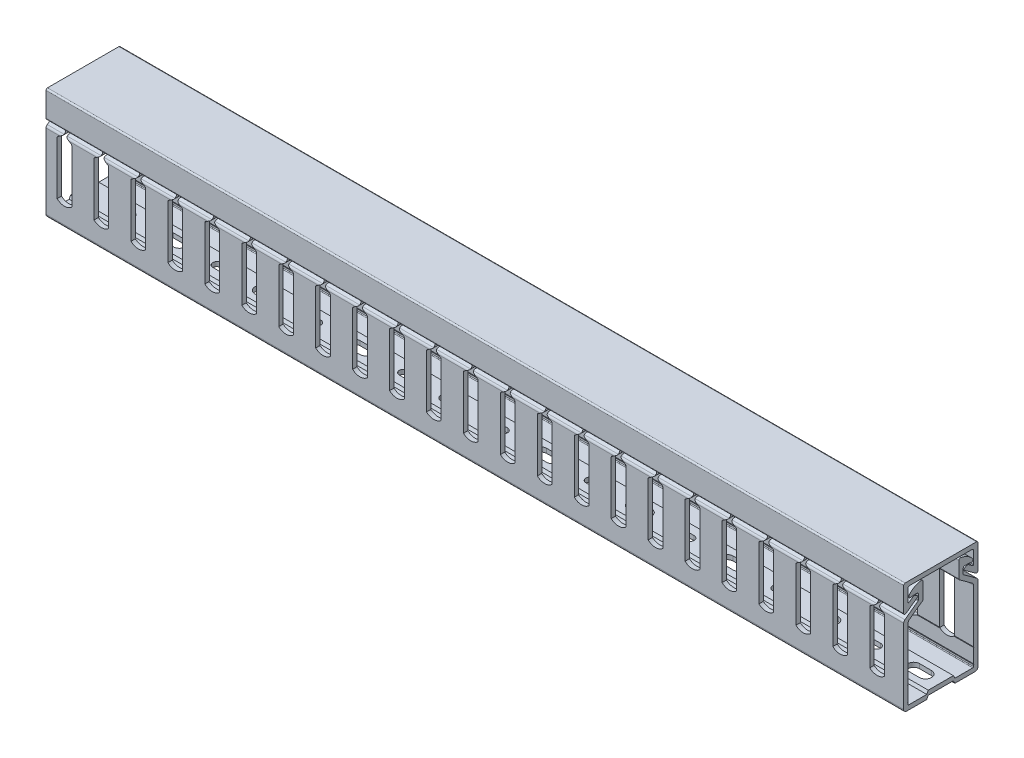
from build123d import *

# Parameters (mm, degrees)
SALIENTE_EXTRUIR1_DEPTH = 381
CORTAR_EXTRUIR3_DEPTH   = 386.164861803
CORTAR_EXTRUIR4_DEPTH   = 386.164861803
CORTAR_EXTRUIR2_DEPTH   = 762
MATRIZL1_COUNT          = 39
MATRIZL1_PITCH          = 19.812
SALIENTE_EXTRUIR2_DEPTH = 762
CROQUIS8_OUTSIDE_W      = 917.078
CROQUIS8_OUTSIDE_H      = 194.956
CROQUIS8_OUTSIDE_W_2    = 460
CROQUIS8_OUTSIDE_H_2    = 39.878350945
CORTAR_EXTRUIR5_DEPTH   = 387.201830564


with BuildPart() as part:
    # Croquis1 → Saliente-Extruir1 (new, symmetric)
    with BuildSketch(Plane(origin=(0, 0, 0), x_dir=(0, 0, -1), z_dir=(1, 0, 0))):
        with BuildLine():
            Line((19.286056746, 41.368511363), (12.158339691, 46.560883065))
            ThreePointArc((12.158339691, 46.560883065), (12.043092654, 46.696079406), (12.001675423, 46.868835138))
            Line((12.001675423, 46.868835138), (12.001675423, 49.62398))
            ThreePointArc((12.001675423, 49.62398), (12.234159416, 50.185246008), (12.795425423, 50.41773))
            Line((12.795425423, 50.41773), (14.716735375, 50.41773))
            ThreePointArc((14.716735375, 50.41773), (14.77958554, 50.415133619), (14.842007404, 50.40736217))
            Line((14.842007404, 50.40736217), (16.273778395, 50.168733671))
            ThreePointArc((16.273778395, 50.168733671), (16.891588094, 50.338944615), (17.161050423, 50.920365841))
            Line((17.161050423, 50.920365841), (17.161050423, 50.965662056))
            ThreePointArc((17.161050423, 50.965662056), (17.083415212, 51.40288764), (16.860001271, 51.786657948))
            ThreePointArc((16.860001271, 51.786657948), (14.087211549, 54.054303711), (10.687972987, 55.183798003))
            ThreePointArc((10.687972987, 55.183798003), (9.959569809, 55.090082211), (9.619819359, 54.438988154))
            Line((9.619819359, 54.438988154), (9.619819359, 45.934160703))
            ThreePointArc((9.619819359, 45.934160703), (9.706169065, 45.574127541), (9.946430695, 45.292428221))
            Line((9.946430695, 45.292428221), (16.905621704, 40.226599498))
            ThreePointArc((16.905621704, 40.226599498), (17.386145054, 39.663200904), (17.558844476, 38.943134534))
            Line((17.558844476, 38.943134534), (17.558844476, 10.388726953))
            Line((17.558844476, 10.388726953), (17.856024476, 10.21715))
            Line((17.856024476, 10.21715), (17.558844476, 10.045573047))
            Line((17.558844476, 10.045573047), (17.558844476, 2.451226953))
            Line((17.558844476, 2.451226953), (17.856024476, 2.27965))
            Line((17.856024476, 2.27965), (17.558844476, 2.108073047))
            Line((17.558844476, 2.108073047), (17.558844476, 1.188085))
            ThreePointArc((17.558844476, 1.188085), (17.44260248, 0.907451996), (17.161969476, 0.79121))
            Line((17.161969476, 0.79121), (7.54125995, 0.79121))
            Line((7.54125995, 0.79121), (6.74687495, 2.37998))
            Line((6.74687495, 2.37998), (3.17499995, 2.37998))
            Line((3.17499995, 2.37998), (-3.17500005, 2.37998))
            Line((-3.17500005, 2.37998), (-6.74687505, 2.37998))
            Line((-6.74687505, 2.37998), (-7.540909103, 0.79121))
            Line((-7.540909103, 0.79121), (-17.161969577, 0.79121))
            ThreePointArc((-17.161969577, 0.79121), (-17.442602581, 0.907451996), (-17.558844577, 1.188085))
            Line((-17.558844577, 1.188085), (-17.558844577, 2.108073047))
            Line((-17.558844577, 2.108073047), (-17.856024577, 2.27965))
            Line((-17.856024577, 2.27965), (-17.558844577, 2.451226953))
            Line((-17.558844577, 2.451226953), (-17.558844577, 10.045573047))
            Line((-17.558844577, 10.045573047), (-17.856024577, 10.21715))
            Line((-17.856024577, 10.21715), (-17.558844577, 10.388726953))
            Line((-17.558844577, 10.388726953), (-17.558844577, 38.943134534))
            ThreePointArc((-17.558844577, 38.943134534), (-17.386145154, 39.663200904), (-16.905621804, 40.226599498))
            Line((-16.905621804, 40.226599498), (-9.946430795, 45.292428221))
            ThreePointArc((-9.946430795, 45.292428221), (-9.70616912, 45.574127519), (-9.619819409, 45.934160703))
            Line((-9.619819409, 45.934160703), (-9.619819409, 54.438988154))
            ThreePointArc((-9.619819409, 54.438988154), (-9.959569859, 55.090082211), (-10.687973038, 55.183798003))
            ThreePointArc((-10.687973038, 55.183798003), (-14.087211599, 54.054303711), (-16.860001321, 51.786657948))
            ThreePointArc((-16.860001321, 51.786657948), (-17.083415262, 51.40288764), (-17.161050473, 50.965662056))
            Line((-17.161050473, 50.965662056), (-17.161050473, 50.920365841))
            ThreePointArc((-17.161050473, 50.920365841), (-16.891588144, 50.338944615), (-16.273778445, 50.168733671))
            Line((-16.273778445, 50.168733671), (-14.842007454, 50.40736217))
            ThreePointArc((-14.842007454, 50.40736217), (-14.77958559, 50.415133619), (-14.716735425, 50.41773))
            Line((-14.716735425, 50.41773), (-12.795425473, 50.41773))
            ThreePointArc((-12.795425473, 50.41773), (-12.234159466, 50.185246008), (-12.001675473, 49.62398))
            Line((-12.001675473, 49.62398), (-12.001675473, 46.868835138))
            ThreePointArc((-12.001675473, 46.868835138), (-12.043092704, 46.696079406), (-12.158339741, 46.560883065))
            Line((-12.158339741, 46.560883065), (-19.286056746, 41.3685114))
            ThreePointArc((-19.286056746, 41.3685114), (-19.766252731, 40.805193314), (-19.938824527, 40.085377764))
            Line((-19.938824527, 40.085377764), (-19.938824527, -0.00127))
            ThreePointArc((-19.938824527, -0.00127), (-19.473856542, -1.123802015), (-18.351324527, -1.58877))
            Line((-18.351324527, -1.58877), (-7.54126, -1.58877))
            Line((-7.54126, -1.58877), (-6.746875, 0))
            Line((-6.746875, 0), (-3.175, 0))
            Line((-3.175, 0), (3.175, 0))
            Line((3.175, 0), (6.746875, 0))
            Line((6.746875, 0), (7.54126, -1.58877))
            Line((7.54126, -1.58877), (18.351324527, -1.58877))
            ThreePointArc((18.351324527, -1.58877), (19.473856542, -1.123802015), (19.938824527, -0.00127))
            Line((19.938824527, -0.00127), (19.938824527, 40.085377727))
            ThreePointArc((19.938824527, 40.085377727), (19.766252731, 40.805193277), (19.286056746, 41.368511363))
        make_face()
    extrude(amount=SALIENTE_EXTRUIR1_DEPTH, both=True)

    # Croquis6 → Cortar-Extruir3 (cut, through all)
    with BuildSketch(Plane(origin=(0, 2.37998, 0), x_dir=(1, 0, 0), z_dir=(0, 1, 0))):
        with BuildLine():
            Line((-382.984375, 3.25), (-379.015625, 3.25))
            ThreePointArc((-379.015625, 3.25), (-375.765625, 0), (-379.015625, -3.25))
            Line((-379.015625, -3.25), (-382.984375, -3.25))
            ThreePointArc((-382.984375, -3.25), (-386.234375, 0), (-382.984375, 3.25))
        make_face()
        with BuildLine():
            Line((-355.7825625, -2.25), (-359.2782375, -2.25))
            ThreePointArc((-359.2782375, -2.25), (-361.5282375, 0), (-359.2782375, 2.25))
            Line((-359.2782375, 2.25), (-355.7825625, 2.25))
            ThreePointArc((-355.7825625, 2.25), (-353.5325625, 0), (-355.7825625, -2.25))
        make_face()
        with BuildLine():
            Line((-305.7445625, -2.25), (-309.2402375, -2.25))
            ThreePointArc((-309.2402375, -2.25), (-311.4902375, 0), (-309.2402375, 2.25))
            Line((-309.2402375, 2.25), (-305.7445625, 2.25))
            ThreePointArc((-305.7445625, 2.25), (-303.4945625, 0), (-305.7445625, -2.25))
        make_face()
        with BuildLine():
            Line((-255.7065625, -2.25), (-259.2022375, -2.25))
            ThreePointArc((-259.2022375, -2.25), (-261.4522375, 0), (-259.2022375, 2.25))
            Line((-259.2022375, 2.25), (-255.7065625, 2.25))
            ThreePointArc((-255.7065625, 2.25), (-253.4565625, 0), (-255.7065625, -2.25))
        make_face()
        with BuildLine():
            Line((-205.6685625, -2.25), (-209.1642375, -2.25))
            ThreePointArc((-209.1642375, -2.25), (-211.4142375, 0), (-209.1642375, 2.25))
            Line((-209.1642375, 2.25), (-205.6685625, 2.25))
            ThreePointArc((-205.6685625, 2.25), (-203.4185625, 0), (-205.6685625, -2.25))
        make_face()
        with BuildLine():
            Line((-155.6305625, -2.25), (-159.1262375, -2.25))
            ThreePointArc((-159.1262375, -2.25), (-161.3762375, 0), (-159.1262375, 2.25))
            Line((-159.1262375, 2.25), (-155.6305625, 2.25))
            ThreePointArc((-155.6305625, 2.25), (-153.3805625, 0), (-155.6305625, -2.25))
        make_face()
        with BuildLine():
            Line((-105.5925625, -2.25), (-109.0882375, -2.25))
            ThreePointArc((-109.0882375, -2.25), (-111.3382375, 0), (-109.0882375, 2.25))
            Line((-109.0882375, 2.25), (-105.5925625, 2.25))
            ThreePointArc((-105.5925625, 2.25), (-103.3425625, 0), (-105.5925625, -2.25))
        make_face()
        with BuildLine():
            Line((-55.5545625, -2.25), (-59.0502375, -2.25))
            ThreePointArc((-59.0502375, -2.25), (-61.3002375, 0), (-59.0502375, 2.25))
            Line((-59.0502375, 2.25), (-55.5545625, 2.25))
            ThreePointArc((-55.5545625, 2.25), (-53.3045625, 0), (-55.5545625, -2.25))
        make_face()
        with BuildLine():
            Line((-5.5165625, -2.25), (-9.0122375, -2.25))
            ThreePointArc((-9.0122375, -2.25), (-11.2622375, 0), (-9.0122375, 2.25))
            Line((-9.0122375, 2.25), (-5.5165625, 2.25))
            ThreePointArc((-5.5165625, 2.25), (-3.2665625, 0), (-5.5165625, -2.25))
        make_face()
        with BuildLine():
            Line((44.5214375, -2.25), (41.0257625, -2.25))
            ThreePointArc((41.0257625, -2.25), (38.7757625, 0), (41.0257625, 2.25))
            Line((41.0257625, 2.25), (44.5214375, 2.25))
            ThreePointArc((44.5214375, 2.25), (46.7714375, 0), (44.5214375, -2.25))
        make_face()
        with BuildLine():
            Line((94.5594375, -2.25), (91.0637625, -2.25))
            ThreePointArc((91.0637625, -2.25), (88.8137625, 0), (91.0637625, 2.25))
            Line((91.0637625, 2.25), (94.5594375, 2.25))
            ThreePointArc((94.5594375, 2.25), (96.8094375, 0), (94.5594375, -2.25))
        make_face()
        with BuildLine():
            Line((144.5974375, -2.25), (141.1017625, -2.25))
            ThreePointArc((141.1017625, -2.25), (138.8517625, 0), (141.1017625, 2.25))
            Line((141.1017625, 2.25), (144.5974375, 2.25))
            ThreePointArc((144.5974375, 2.25), (146.8474375, 0), (144.5974375, -2.25))
        make_face()
        with BuildLine():
            Line((194.6354375, -2.25), (191.1397625, -2.25))
            ThreePointArc((191.1397625, -2.25), (188.8897625, 0), (191.1397625, 2.25))
            Line((191.1397625, 2.25), (194.6354375, 2.25))
            ThreePointArc((194.6354375, 2.25), (196.8854375, 0), (194.6354375, -2.25))
        make_face()
        with BuildLine():
            Line((244.6734375, -2.25), (241.1777625, -2.25))
            ThreePointArc((241.1777625, -2.25), (238.9277625, 0), (241.1777625, 2.25))
            Line((241.1777625, 2.25), (244.6734375, 2.25))
            ThreePointArc((244.6734375, 2.25), (246.9234375, 0), (244.6734375, -2.25))
        make_face()
        with BuildLine():
            Line((294.7114375, -2.25), (291.2157625, -2.25))
            ThreePointArc((291.2157625, -2.25), (288.9657625, 0), (291.2157625, 2.25))
            Line((291.2157625, 2.25), (294.7114375, 2.25))
            ThreePointArc((294.7114375, 2.25), (296.9614375, 0), (294.7114375, -2.25))
        make_face()
        with BuildLine():
            Line((344.7494375, -2.25), (341.2537625, -2.25))
            ThreePointArc((341.2537625, -2.25), (339.0037625, 0), (341.2537625, 2.25))
            Line((341.2537625, 2.25), (344.7494375, 2.25))
            ThreePointArc((344.7494375, 2.25), (346.9994375, 0), (344.7494375, -2.25))
        make_face()
        with BuildLine():
            Line((394.7874375, -2.25), (391.2917625, -2.25))
            ThreePointArc((391.2917625, -2.25), (389.0417625, 0), (391.2917625, 2.25))
            Line((391.2917625, 2.25), (394.7874375, 2.25))
            ThreePointArc((394.7874375, 2.25), (397.0374375, 0), (394.7874375, -2.25))
        make_face()
    extrude(amount=-CORTAR_EXTRUIR3_DEPTH, mode=Mode.SUBTRACT)

    # Croquis7 → Cortar-Extruir4 (cut, through all)
    with BuildSketch(Plane(origin=(0, 2.37998, 0), x_dir=(1, 0, 0), z_dir=(0, 1, 0))):
        with BuildLine():
            Line((-335.6864, 3.2512), (-329.3364, 3.2512))
            ThreePointArc((-329.3364, 3.2512), (-326.0852, 0), (-329.3364, -3.2512))
            Line((-329.3364, -3.2512), (-335.6864, -3.2512))
            ThreePointArc((-335.6864, -3.2512), (-338.9376, 0), (-335.6864, 3.2512))
        make_face()
        with BuildLine():
            Line((-285.6738, 3.2512), (-279.3238, 3.2512))
            ThreePointArc((-279.3238, 3.2512), (-276.0726, 0), (-279.3238, -3.2512))
            Line((-279.3238, -3.2512), (-285.6738, -3.2512))
            ThreePointArc((-285.6738, -3.2512), (-288.925, 0), (-285.6738, 3.2512))
        make_face()
        with BuildLine():
            Line((-235.6612, 3.2512), (-229.3112, 3.2512))
            ThreePointArc((-229.3112, 3.2512), (-226.06, 0), (-229.3112, -3.2512))
            Line((-229.3112, -3.2512), (-235.6612, -3.2512))
            ThreePointArc((-235.6612, -3.2512), (-238.9124, 0), (-235.6612, 3.2512))
        make_face()
        with BuildLine():
            Line((-185.6486, 3.2512), (-179.2986, 3.2512))
            ThreePointArc((-179.2986, 3.2512), (-176.0474, 0), (-179.2986, -3.2512))
            Line((-179.2986, -3.2512), (-185.6486, -3.2512))
            ThreePointArc((-185.6486, -3.2512), (-188.8998, 0), (-185.6486, 3.2512))
        make_face()
        with BuildLine():
            Line((-135.636, 3.2512), (-129.286, 3.2512))
            ThreePointArc((-129.286, 3.2512), (-126.0348, 0), (-129.286, -3.2512))
            Line((-129.286, -3.2512), (-135.636, -3.2512))
            ThreePointArc((-135.636, -3.2512), (-138.8872, 0), (-135.636, 3.2512))
        make_face()
        with BuildLine():
            Line((-85.6234, 3.2512), (-79.2734, 3.2512))
            ThreePointArc((-79.2734, 3.2512), (-76.0222, 0), (-79.2734, -3.2512))
            Line((-79.2734, -3.2512), (-85.6234, -3.2512))
            ThreePointArc((-85.6234, -3.2512), (-88.8746, 0), (-85.6234, 3.2512))
        make_face()
        with BuildLine():
            Line((-35.6108, 3.2512), (-29.2608, 3.2512))
            ThreePointArc((-29.2608, 3.2512), (-26.0096, 0), (-29.2608, -3.2512))
            Line((-29.2608, -3.2512), (-35.6108, -3.2512))
            ThreePointArc((-35.6108, -3.2512), (-38.862, 0), (-35.6108, 3.2512))
        make_face()
        with BuildLine():
            Line((14.4018, 3.2512), (20.7518, 3.2512))
            ThreePointArc((20.7518, 3.2512), (24.003, 0), (20.7518, -3.2512))
            Line((20.7518, -3.2512), (14.4018, -3.2512))
            ThreePointArc((14.4018, -3.2512), (11.1506, 0), (14.4018, 3.2512))
        make_face()
        with BuildLine():
            Line((64.4144, 3.2512), (70.7644, 3.2512))
            ThreePointArc((70.7644, 3.2512), (74.0156, 0), (70.7644, -3.2512))
            Line((70.7644, -3.2512), (64.4144, -3.2512))
            ThreePointArc((64.4144, -3.2512), (61.1632, 0), (64.4144, 3.2512))
        make_face()
        with BuildLine():
            Line((114.427, 3.2512), (120.777, 3.2512))
            ThreePointArc((120.777, 3.2512), (124.0282, 0), (120.777, -3.2512))
            Line((120.777, -3.2512), (114.427, -3.2512))
            ThreePointArc((114.427, -3.2512), (111.1758, 0), (114.427, 3.2512))
        make_face()
        with BuildLine():
            Line((164.4396, 3.2512), (170.7896, 3.2512))
            ThreePointArc((170.7896, 3.2512), (174.0408, 0), (170.7896, -3.2512))
            Line((170.7896, -3.2512), (164.4396, -3.2512))
            ThreePointArc((164.4396, -3.2512), (161.1884, 0), (164.4396, 3.2512))
        make_face()
        with BuildLine():
            Line((214.4522, 3.2512), (220.8022, 3.2512))
            ThreePointArc((220.8022, 3.2512), (224.0534, 0), (220.8022, -3.2512))
            Line((220.8022, -3.2512), (214.4522, -3.2512))
            ThreePointArc((214.4522, -3.2512), (211.201, 0), (214.4522, 3.2512))
        make_face()
        with BuildLine():
            Line((264.4648, 3.2512), (270.8148, 3.2512))
            ThreePointArc((270.8148, 3.2512), (274.066, 0), (270.8148, -3.2512))
            Line((270.8148, -3.2512), (264.4648, -3.2512))
            ThreePointArc((264.4648, -3.2512), (261.2136, 0), (264.4648, 3.2512))
        make_face()
        with BuildLine():
            Line((314.4774, 3.2512), (320.8274, 3.2512))
            ThreePointArc((320.8274, 3.2512), (324.0786, 0), (320.8274, -3.2512))
            Line((320.8274, -3.2512), (314.4774, -3.2512))
            ThreePointArc((314.4774, -3.2512), (311.2262, 0), (314.4774, 3.2512))
        make_face()
        with BuildLine():
            Line((364.49, 3.2512), (370.84, 3.2512))
            ThreePointArc((370.84, 3.2512), (374.0912, 0), (370.84, -3.2512))
            Line((370.84, -3.2512), (364.49, -3.2512))
            ThreePointArc((364.49, -3.2512), (361.2388, 0), (364.49, 3.2512))
        make_face()
    extrude(amount=-CORTAR_EXTRUIR4_DEPTH, mode=Mode.SUBTRACT)

    # Croquis4 → Cortar-Extruir2 (cut)
    with BuildSketch(Plane.XY.offset(19.938824527)):
        with BuildLine():
            Line((-368.615249236, 40.085377764), (-373.572750764, 40.085377764))
            Line((-373.572750764, 40.085377764), (-374.7135, 39.366619083))
            ThreePointArc((-374.7135, 39.366619083), (-374.947201583, 39.086594874), (-375.031, 38.731619083))
            Line((-375.031, 38.731619083), (-375.031, 23.997362537))
            Line((-375.031, 23.997362537), (-375.031, 10.24763))
            ThreePointArc((-375.031, 10.24763), (-371.094, 8.695321482), (-367.157, 10.24763))
            Line((-367.157, 10.24763), (-367.157, 23.997362537))
            Line((-367.157, 23.997362537), (-367.157, 38.731619083))
            ThreePointArc((-367.157, 38.731619083), (-367.240798417, 39.086594874), (-367.4745, 39.366619083))
            Line((-367.4745, 39.366619083), (-368.615249236, 40.085377764))
        make_face()
        with BuildLine():
            ThreePointArc((-367.157, 54.438988154), (-366.924516008, 55.000254161), (-366.36325, 55.232738154))
            Line((-366.36325, 55.232738154), (-375.82475, 55.232738154))
            ThreePointArc((-375.82475, 55.232738154), (-375.263483992, 55.000254161), (-375.031, 54.438988154))
            Line((-375.031, 54.438988154), (-375.031, 44.399366703))
            ThreePointArc((-375.031, 44.399366703), (-374.947201583, 44.044390912), (-374.7135, 43.764366703))
            Line((-374.7135, 43.764366703), (-372.23145992, 42.200492893))
            ThreePointArc((-372.23145992, 42.200492893), (-371.91395992, 41.565492893), (-372.23145992, 40.930492893))
            Line((-372.23145992, 40.930492893), (-373.572750764, 40.085377764))
            Line((-373.572750764, 40.085377764), (-368.615249236, 40.085377764))
            Line((-368.615249236, 40.085377764), (-369.95654008, 40.930492893))
            ThreePointArc((-369.95654008, 40.930492893), (-370.27404008, 41.565492893), (-369.95654008, 42.200492893))
            Line((-369.95654008, 42.200492893), (-367.4745, 43.764366703))
            ThreePointArc((-367.4745, 43.764366703), (-367.240798417, 44.044390912), (-367.157, 44.399366703))
            Line((-367.157, 44.399366703), (-367.157, 54.438988154))
        make_face()
    cortar_extruir2 = extrude(amount=-CORTAR_EXTRUIR2_DEPTH, mode=Mode.SUBTRACT)

    # MatrizL1: Cortar-Extruir2 ×39
    with Locations(*[(i * MATRIZL1_PITCH, 0, 0) for i in range(1, MATRIZL1_COUNT)]):
        add(cortar_extruir2, mode=Mode.SUBTRACT)


with BuildPart() as body_2:
    # Croquis2 → Saliente-Extruir2 (new body)
    with BuildSketch(Plane(origin=(381, 0, 0), x_dir=(0, 0, -1), z_dir=(1, 0, 0))):
        with BuildLine():
            Line((-19.145425473, 58.35523), (19.145425472, 58.35523))
            ThreePointArc((19.145425472, 58.35523), (19.70669148, 58.122746008), (19.939175472, 57.56148))
            Line((19.939175472, 57.56148), (19.939175472, 44.626086298))
            ThreePointArc((19.939175472, 44.626086298), (19.507579131, 43.919769238), (18.682145451, 43.981562688))
            Line((18.682145451, 43.981562688), (12.520125794, 48.410788482))
            ThreePointArc((12.520125794, 48.410788482), (12.368277087, 48.64861921), (12.421691504, 48.925690294))
            ThreePointArc((12.421691504, 48.925690294), (13.049719092, 49.580918783), (13.879271707, 49.949138126))
            ThreePointArc((13.879271707, 49.949138126), (14.546176776, 49.956934681), (15.157427866, 49.690110277))
            Line((15.157427866, 49.690110277), (17.155403277, 48.253976554))
            ThreePointArc((17.155403277, 48.253976554), (17.419512788, 48.234187646), (17.557652876, 48.460158331))
            Line((17.557652876, 48.460158331), (17.559393439, 55.181294444))
            ThreePointArc((17.559393439, 55.181294444), (17.326982144, 55.742693328), (16.765643466, 55.97525))
            Line((16.765643466, 55.97525), (-16.765643466, 55.97525))
            ThreePointArc((-16.765643466, 55.97525), (-17.326982144, 55.742693328), (-17.559393439, 55.181294444))
            Line((-17.559393439, 55.181294444), (-17.557652876, 48.460158331))
            ThreePointArc((-17.557652876, 48.460158331), (-17.419512789, 48.234187647), (-17.155403279, 48.253976554))
            Line((-17.155403279, 48.253976554), (-15.157427868, 49.690110277))
            ThreePointArc((-15.157427868, 49.690110277), (-14.546176778, 49.956934681), (-13.879271708, 49.949138126))
            ThreePointArc((-13.879271708, 49.949138126), (-13.049719093, 49.580918783), (-12.421691505, 48.925690294))
            ThreePointArc((-12.421691505, 48.925690294), (-12.368277088, 48.64861921), (-12.520125795, 48.410788482))
            Line((-12.520125795, 48.410788482), (-18.682145452, 43.981562688))
            ThreePointArc((-18.682145452, 43.981562688), (-19.507579132, 43.919769238), (-19.939175473, 44.626086298))
            Line((-19.939175473, 44.626086298), (-19.939175473, 57.56148))
            ThreePointArc((-19.939175473, 57.56148), (-19.706691481, 58.122746008), (-19.145425473, 58.35523))
        make_face()
    extrude(amount=-SALIENTE_EXTRUIR2_DEPTH)


with BuildPart() as cortar_extruir5_tool:
    # Croquis8 outside → Cortar-Extruir5 (new, through all)
    with BuildSketch(Plane(origin=(0, 58.35523, 0), x_dir=(1, 0, 0), z_dir=(0, 1, 0))):
        Rectangle(CROQUIS8_OUTSIDE_W, CROQUIS8_OUTSIDE_H)
        with Locations((-151, -1e-09)):
            Rectangle(CROQUIS8_OUTSIDE_W_2, CROQUIS8_OUTSIDE_H_2, mode=Mode.SUBTRACT)
    extrude(amount=-CORTAR_EXTRUIR5_DEPTH)


with BuildPart() as part_1:
    add(part.part)

    # Cortar-Extruir5: cut by cortar_extruir5_tool
    add(cortar_extruir5_tool.part, mode=Mode.SUBTRACT)


with BuildPart() as body_2_1:
    add(body_2.part)

    # Cortar-Extruir5: cut by cortar_extruir5_tool
    add(cortar_extruir5_tool.part, mode=Mode.SUBTRACT)


solid = Compound([part_1.part, body_2_1.part])
